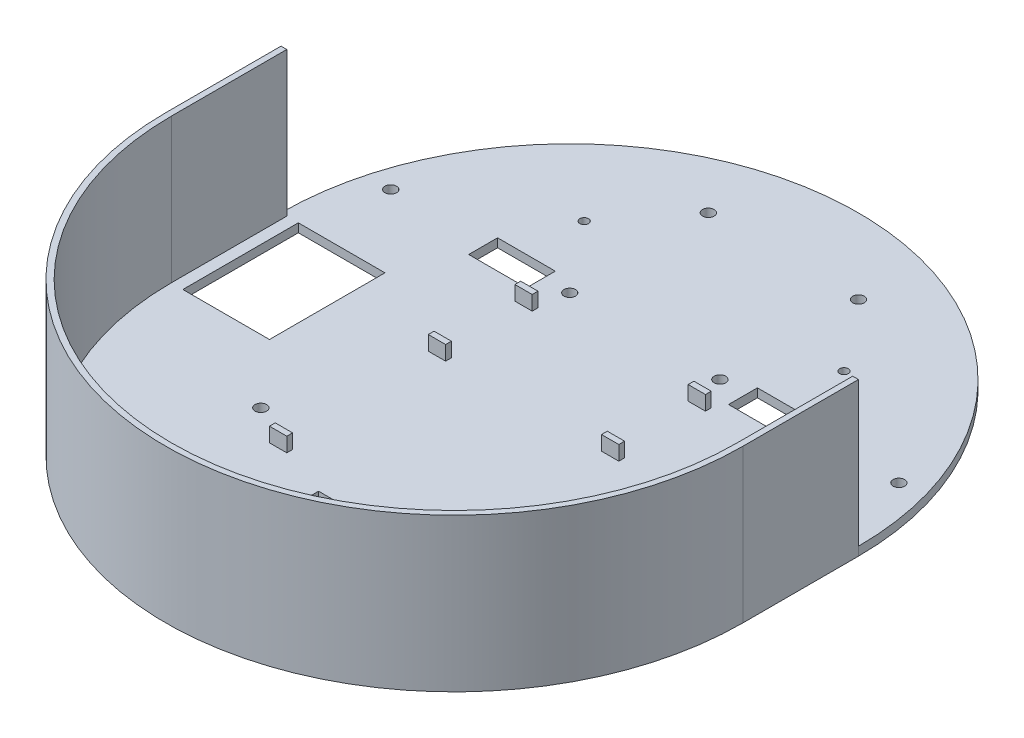
from build123d import *

# Parameters (mm, degrees)
SKETCH_1_R             = 100
SKETCH_1_W             = 200
SKETCH_1_H             = 40
EXTRUDE_481_DEPTH      = 3
EXTRUDE_967_DEPTH      = 50
SKETCH_3_W             = 30
SKETCH_3_H             = 40
SKETCH_3_W_2           = 20
SKETCH_3_H_2           = 10
SKETCH_3_H_3           = 30
CUT_EXTRUDE_1916_DEPTH = 3
SKETCH_2_R             = 2
SKETCH_2_R_2           = 1.5
CUT_EXTRUDE_3176_DEPTH = 180.164728672
SKETCH_6_W             = 6
SKETCH_6_H             = 2
EXTRUDE_4167_DEPTH     = 5


with BuildPart() as part:
    # 草图1 → Extrude 481 (new body)
    with BuildSketch(Plane(origin=(0, 0, 0), x_dir=(1, 0, 0), z_dir=(0, 1, 0))):
        Circle(SKETCH_1_R)
        with Locations((0, 40)):
            Circle(SKETCH_1_R)
        with Locations((0, 20)):
            Rectangle(SKETCH_1_W, SKETCH_1_H)
    extrude(amount=EXTRUDE_481_DEPTH)

    # 草图5 → Extrude 967 (add)
    with BuildSketch(Plane(origin=(0, 3, 0), x_dir=(1, 0, 0), z_dir=(0, 1, 0))):
        with BuildLine():
            Line((-98, 0), (-98, 40))
            Line((-98, 40), (-100, 40))
            Line((-100, 40), (-100, 0))
            ThreePointArc((-100, 0), (0, -100), (100, 0))
            Line((100, 0), (100, 40))
            Line((100, 40), (98, 40))
            Line((98, 40), (98, 0))
            ThreePointArc((98, 0), (0, -98), (-98, 0))
        make_face()
    extrude(amount=EXTRUDE_967_DEPTH)

    # 草图3 → Cut-Extrude 1916 (cut)
    with BuildSketch(Plane(origin=(0, 3, 0), x_dir=(1, 0, 0), z_dir=(0, 1, 0))):
        with Locations((-79, 20)):
            Rectangle(SKETCH_3_W, SKETCH_3_H)
        with Locations((79, 20)):
            Rectangle(SKETCH_3_W, SKETCH_3_H)
        with Locations((45, 65)):
            Rectangle(SKETCH_3_W_2, SKETCH_3_H_2)
        with Locations((0, -52)):
            Rectangle(SKETCH_3_W_2, SKETCH_3_H_3)
        with Locations((-45, 65)):
            Rectangle(SKETCH_3_W_2, SKETCH_3_H_2)
    extrude(amount=-CUT_EXTRUDE_1916_DEPTH, mode=Mode.SUBTRACT)

    # 草图2 → Cut-Extrude 3176 (cut, through all)
    with BuildSketch(Plane(origin=(0, 3, 0), x_dir=(1, 0, 0), z_dir=(0, 1, 0))):
        with Locations((-45, -22)):
            Circle(SKETCH_2_R)
        with Locations((-40, -82)):
            Circle(SKETCH_2_R)
        with Locations((-88, 66)):
            Circle(SKETCH_2_R)
        with Locations((-26, 66)):
            Circle(SKETCH_2_R)
        with Locations((-26, 114)):
            Circle(SKETCH_2_R)
        with Locations((40, -82)):
            Circle(SKETCH_2_R)
        with Locations((45, -22)):
            Circle(SKETCH_2_R)
        with Locations((26, 114)):
            Circle(SKETCH_2_R)
        with Locations((26, 66)):
            Circle(SKETCH_2_R)
        with Locations((88, 66)):
            Circle(SKETCH_2_R)
        with Locations((-45, 90)):
            Circle(SKETCH_2_R_2)
        with Locations((45, 90)):
            Circle(SKETCH_2_R_2)
    extrude(amount=-CUT_EXTRUDE_3176_DEPTH, mode=Mode.SUBTRACT)

    # 草图6 → Extrude 4167 (add)
    with BuildSketch(Plane(origin=(0, 3, 0), x_dir=(1, 0, 0), z_dir=(0, 1, 0))):
        with Locations((-30, -30)):
            Rectangle(SKETCH_6_W, SKETCH_6_H)
        with Locations((-30, -60)):
            Rectangle(SKETCH_6_W, SKETCH_6_H)
        with Locations((-30, 25)):
            Rectangle(SKETCH_6_W, SKETCH_6_H)
        with Locations((-30, 55)):
            Rectangle(SKETCH_6_W, SKETCH_6_H)
        with Locations((30, -60)):
            Rectangle(SKETCH_6_W, SKETCH_6_H)
        with Locations((30, -30)):
            Rectangle(SKETCH_6_W, SKETCH_6_H)
        with Locations((30, 55)):
            Rectangle(SKETCH_6_W, SKETCH_6_H)
        with Locations((30, 25)):
            Rectangle(SKETCH_6_W, SKETCH_6_H)
    extrude(amount=EXTRUDE_4167_DEPTH)


solid = part.part
